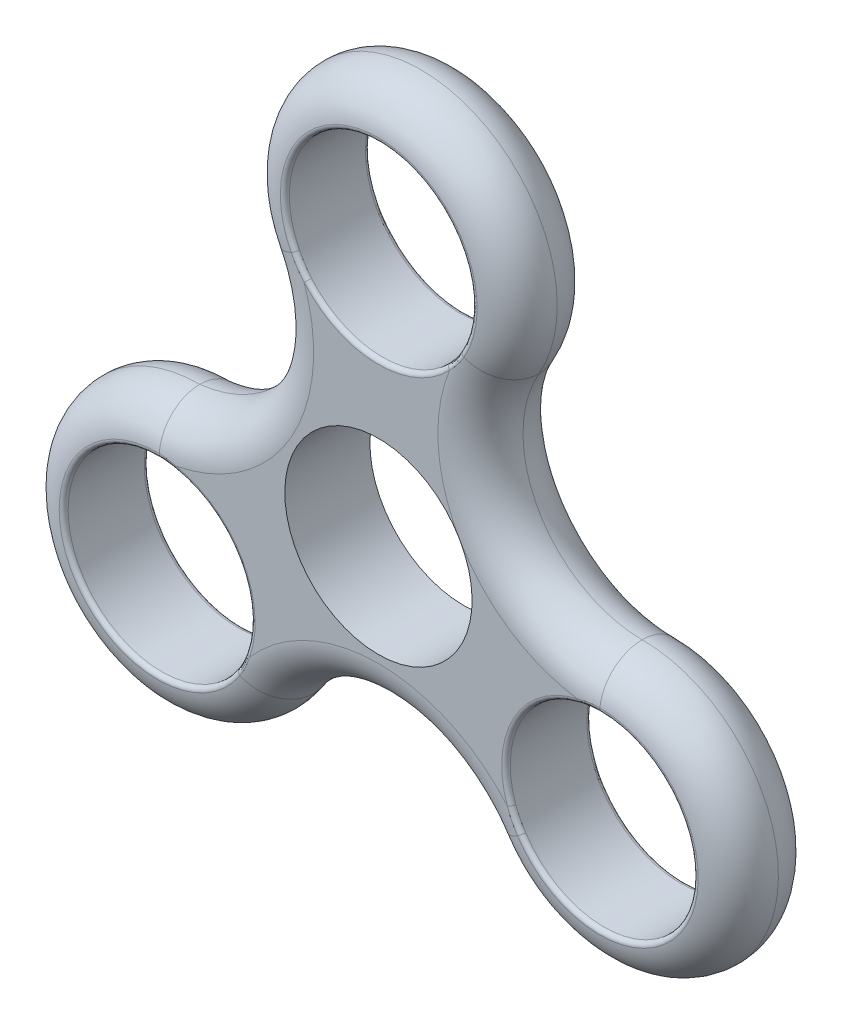
from build123d import *

# Parameters (mm, degrees)
SKETCH1_R           = 11
BOSS_EXTRUDE1_DEPTH = 10
FILLET10_R          = 5
FILLET11_R          = 5
FILLET16_R          = 0.5


with BuildPart() as part:
    # Sketch1 → Boss-Extrude1 (new body)
    with BuildSketch(Plane.XY):
        with BuildLine():
            ThreePointArc((13.856406461, 22), (0.414370618, 45.994633381), (-14.252050697, 22.728201671))
            ThreePointArc((-14.252050697, 22.728201671), (-14.413620061, 8.785781869), (-25.980762114, 1))
            ThreePointArc((-25.980762114, 1), (-40.045905966, -22.627039295), (-12.571336507, -23.728533949))
            ThreePointArc((-12.571336507, -23.728533949), (0, -16.911534525), (12.571336507, -23.728533949))
            ThreePointArc((12.571336507, -23.728533949), (40.045905966, -22.627039295), (25.980762114, 1))
            ThreePointArc((25.980762114, 1), (13.856406461, 8), (13.856406461, 22))
        make_face()
        with Locations((-25.980762114, -15)):
            Circle(SKETCH1_R, mode=Mode.SUBTRACT)
        Circle(SKETCH1_R, mode=Mode.SUBTRACT)
        with Locations((0, 30)):
            Circle(SKETCH1_R, mode=Mode.SUBTRACT)
        with Locations((25.980762114, -15)):
            Circle(SKETCH1_R, mode=Mode.SUBTRACT)
    extrude(amount=BOSS_EXTRUDE1_DEPTH)

    # Fillet10
    fillet10_edges = [part.edges().sort_by_distance(p)[0] for p in [
        (40.045905966, -22.627039295, 0),
        (0, -16.911534525, 0),
        (-40.045905966, -22.627039295, 0),
        (-14.413620061, 8.785781869, 0),
        (0.414370618, 45.994633381, 0),
        (13.856406461, 8, 0),
    ]]
    fillet(fillet10_edges, radius=FILLET10_R - 0.0001)  # a hair under: the kernel refuses the full size

    # Fillet11
    fillet11_edges = [part.edges().sort_by_distance(p)[0] for p in [
        (-40.045905966, -22.627039295, 10),
        (-14.413620061, 8.785781869, 10),
        (0.414370618, 45.994633381, 10),
        (13.856406461, 8, 10),
        (40.045905966, -22.627039295, 10),
        (0, -16.911534525, 10),
    ]]
    fillet(fillet11_edges, radius=FILLET11_R - 0.0001)  # a hair under: the kernel refuses the full size

    # Fillet16
    fillet16_edges = [part.edges().sort_by_distance(p)[0] for p in [
        (-36.980762114, -15, 0),
        (-36.980762114, -15, 0),
        (-36.980762114, -15, 10),
        (-36.980762114, -15, 10),
        (-11, 30, 0),
        (-11, 30, 0),
        (-11, 30, 10),
        (-11, 30, 10),
        (14.980762114, -15, 0),
        (14.980762114, -15, 0),
        (14.980762114, -15, 10),
        (14.980762114, -15, 10),
    ]]
    fillet(fillet16_edges, radius=FILLET16_R)


solid = part.part
